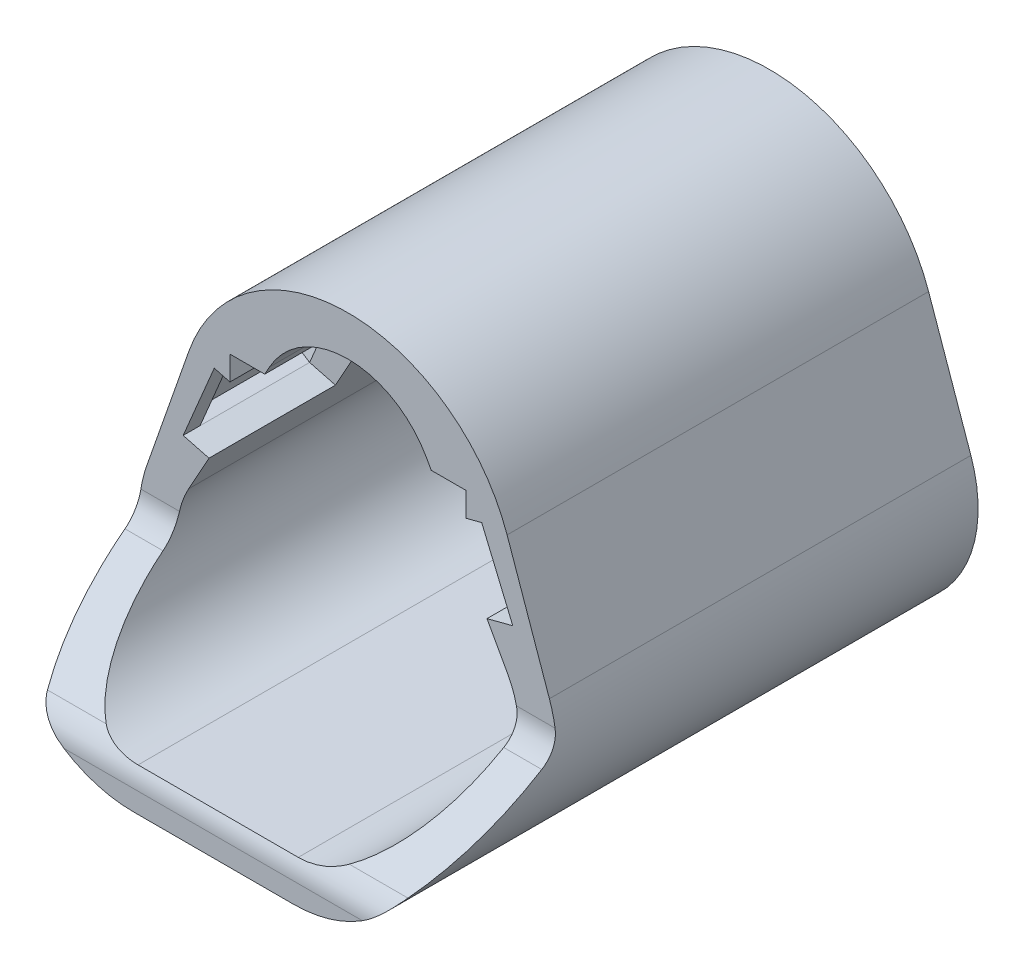
from build123d import *

# Parameters (mm, degrees)
RESSALTO_EXTRUS_O1_DEPTH   = 66
CORTE_EXTRUS_O1_DEPTH      = 53.5
CORTE_EXTRUS_O2_DEPTH      = 9.5
ESBO_O5_W                  = 2
ESBO_O5_H                  = 8
CORTE_EXTRUS_O3_DEPTH      = 72.859720289
CORTE_EXTRUS_O4_DEPTH      = 75.503821379
CORTE_EXTRUS_O4_DEPTH_BACK = 75.503821379
CORTE_EXTRUS_O6_DEPTH      = 15
ESBO_O10_W                 = 13
ESBO_O10_H                 = 9.498093923
CORTE_EXTRUS_O7_DEPTH      = 1.8
CORTE_EXTRUS_O7_DRAFT      = 23
ESBO_O11_W                 = 13
ESBO_O11_H                 = 9.498093923
CORTE_EXTRUS_O8_DEPTH      = 1.8
CORTE_EXTRUS_O8_DRAFT      = 23
FILETE10_START             = -24.75
FILETE10_DEPTH             = 49.5
FILETE11_R                 = 4
FILETE12_R                 = 4
CORTE_EXTRUS_O9_DEPTH      = 47


with BuildPart() as part:
    # Esboço2 → Ressalto-extrusão1 (new body)
    with BuildSketch(Plane.XY):
        with BuildLine():
            Line((18.875125561, 10.742838653), (23.89228324, -3.577710527))
            ThreePointArc((23.89228324, -3.577710527), (21.938999447, -17.442346217), (9.5, -23.87))
            Line((9.5, -23.87), (-9.5, -23.87))
            ThreePointArc((-9.5, -23.87), (-21.938999447, -17.442346217), (-23.89228324, -3.577710527))
            Line((-23.89228324, -3.577710527), (-18.875125561, 10.742838653))
            ThreePointArc((-18.875125561, 10.742838653), (0, 24.13), (18.875125561, 10.742838653))
        make_face()
    extrude(amount=RESSALTO_EXTRUS_O1_DEPTH)

    # Esboço3 → Corte-extrusão1 (cut)
    with BuildSketch(Plane.XY.offset(66)):
        with BuildLine():
            Line((-9.315367954, 13.892017036), (-18.902836198, -3.409513321))
            ThreePointArc((-18.902836198, -3.409513321), (-18.762160434, -14.076636702), (-9.5, -19.37))
            Line((-9.5, -19.37), (9.5, -19.37))
            ThreePointArc((9.5, -19.37), (18.762160434, -14.076636702), (18.902836198, -3.409513321))
            Line((18.902836198, -3.409513321), (9.315367954, 13.892017036))
            ThreePointArc((9.315367954, 13.892017036), (0, 19.38), (-9.315367954, 13.892017036))
        make_face()
    extrude(amount=-CORTE_EXTRUS_O1_DEPTH, mode=Mode.SUBTRACT)

    # Esboço4 → Corte-extrusão2 (cut)
    with BuildSketch(Plane.XY.offset(12.5)):
        with BuildLine():
            Line((-9.315367954, 13.892017036), (-18.88094029, -3.37))
            Line((-18.88094029, -3.37), (18.88094029, -3.37))
            Line((18.88094029, -3.37), (9.315367954, 13.892017036))
            ThreePointArc((9.315367954, 13.892017036), (0, 19.38), (-9.315367954, 13.892017036))
        make_face()
    extrude(amount=-CORTE_EXTRUS_O2_DEPTH, mode=Mode.SUBTRACT)

    # Esboço5 → Corte-extrusão3 (cut, through all)
    with BuildSketch(Plane.XY.offset(3)):
        with Locations((-6, 7.13)):
            Rectangle(ESBO_O5_W, ESBO_O5_H)
        with Locations((6, 7.13)):
            Rectangle(ESBO_O5_W, ESBO_O5_H)
    extrude(amount=-CORTE_EXTRUS_O3_DEPTH, mode=Mode.SUBTRACT)

    # Esboço6 → Corte-extrusão4 (cut, two sides: drawn at the far end of the back side and taken through both)
    with BuildSketch(Plane(origin=(0, 0, 0), x_dir=(0, 0, -1), z_dir=(1, 0, 0)).offset(-CORTE_EXTRUS_O4_DEPTH_BACK)):
        Polygon((-73.252948894, -8.37), (-72.738467135, 18.869608141), (-69.396784042, 24.687681426), (-65.169347817, 25.830591912), (-50, 27.529066054), (-50, -8.37), (-66, -19.37), (-66, -23.87), (-79.476934269, -23.87), (-79.476934269, -8.37), align=None)
    extrude(amount=CORTE_EXTRUS_O4_DEPTH + CORTE_EXTRUS_O4_DEPTH_BACK, mode=Mode.SUBTRACT)

    # Esboço7 → Corte-extrusão6 (cut)
    with BuildSketch(Plane.XY.offset(50)):
        Polygon((0, -3.37), (19.549187838, 1.7499651), (15.86238212, 10.5033217), (2e-09, 6.348937203), (-15.862382121, 10.5033217), (-19.549187841, 1.7499651), align=None)
    extrude(amount=-CORTE_EXTRUS_O6_DEPTH, mode=Mode.SUBTRACT)


with BuildPart() as corte_extrus_o7_tool:
    # Esboço10 → Corte-extrusão7 (with draft: the straight prism first)
    with BuildSketch(Plane(origin=(17.229716404, 7.256943806, 0), x_dir=(0, 0, 1), z_dir=(-0.9215908655875538, -0.3881626932944273, 0))):
        with Locations((41.5, -1.226466591)):
            Rectangle(ESBO_O10_W, ESBO_O10_H)
    extrude(amount=-CORTE_EXTRUS_O7_DEPTH)
    # Corte-extrusão7: the draft: its side faces are tilted about the plane it starts from
    corte_extrus_o7_sides = [corte_extrus_o7_tool.faces().sort_by_distance(p)[0] for p in [
        (16.691813899, 10.852668124, 41.5),
        (18.535216758, 6.475989824, 35),
        (20.378619617, 2.099311524, 41.5),
        (18.535216758, 6.475989824, 48),
    ]]
    draft(corte_extrus_o7_sides, Plane(origin=(17.229716404, 7.256943806, 0), x_dir=(0, 0, 1), z_dir=(-0.9215908655875538, -0.3881626932944273, 0)), CORTE_EXTRUS_O7_DRAFT)


with BuildPart() as part_1:
    add(part.part)

    # Corte-extrusão7: cut by corte_extrus_o7_tool
    add(corte_extrus_o7_tool.part, mode=Mode.SUBTRACT)


with BuildPart() as corte_extrus_o8_tool:
    # Esboço11 → Corte-extrusão8 (with draft: the straight prism first)
    with BuildSketch(Plane(origin=(-17.229716404, 7.256943809, 0), x_dir=(0, 0, -1), z_dir=(0.9215908655337633, -0.3881626934221387, 0))):
        with Locations((-41.5, -1.226466593)):
            Rectangle(ESBO_O11_W, ESBO_O11_H)
    extrude(amount=-CORTE_EXTRUS_O8_DEPTH)
    # Corte-extrusão8: the draft: its side faces are tilted about the plane it starts from
    corte_extrus_o8_sides = [corte_extrus_o8_tool.faces().sort_by_distance(p)[0] for p in [
        (-18.53521676, 6.475989824, 48),
        (-20.37861962, 2.099311524, 41.5),
        (-18.53521676, 6.475989824, 35),
        (-16.6918139, 10.852668124, 41.5),
    ]]
    draft(corte_extrus_o8_sides, Plane(origin=(-17.229716404, 7.256943809, 0), x_dir=(0, 0, -1), z_dir=(0.9215908655337633, -0.3881626934221387, 0)), CORTE_EXTRUS_O8_DRAFT)


with BuildPart() as part_2:
    add(part_1.part)

    # Corte-extrusão8: cut by corte_extrus_o8_tool
    add(corte_extrus_o8_tool.part, mode=Mode.SUBTRACT)

    # Filete10: read off the stored shape, not the designer's step
    # Filete10 outline → Filete10 (cut)
    with BuildSketch(Plane.YZ.offset(FILETE10_START)):
        with BuildLine():
            ThreePointArc((-21.47412196, 66), (-19.611926245, 65.540088576), (-18.177953073, 64.266113561))
            Line((-18.177953073, 64.266113561), (-19.37, 66))
            Line((-19.37, 66), (-21.47412196, 66))
        make_face()
    extrude(amount=FILETE10_DEPTH, mode=Mode.SUBTRACT)

    # Filete11
    filete11_edges = [part_2.edges().sort_by_distance(p)[0] for p in [
        (-22.497521656, -8.37, 50),
    ]]
    fillet(filete11_edges, radius=FILETE11_R)

    # Filete12
    filete12_edges = [part_2.edges().sort_by_distance(p)[0] for p in [
        (22.497521656, -8.37, 50),
    ]]
    fillet(filete12_edges, radius=FILETE12_R)

    # Esboço12 → Corte-extrusão9 (cut)
    with BuildSketch(Plane.XY.offset(50)):
        Polygon((14, 12.88), (14, 7.88), (-14, 7.88), (-14, 12.88), (0, 12.88), align=None)
    extrude(amount=-CORTE_EXTRUS_O9_DEPTH, mode=Mode.SUBTRACT)


solid = part_2.part
